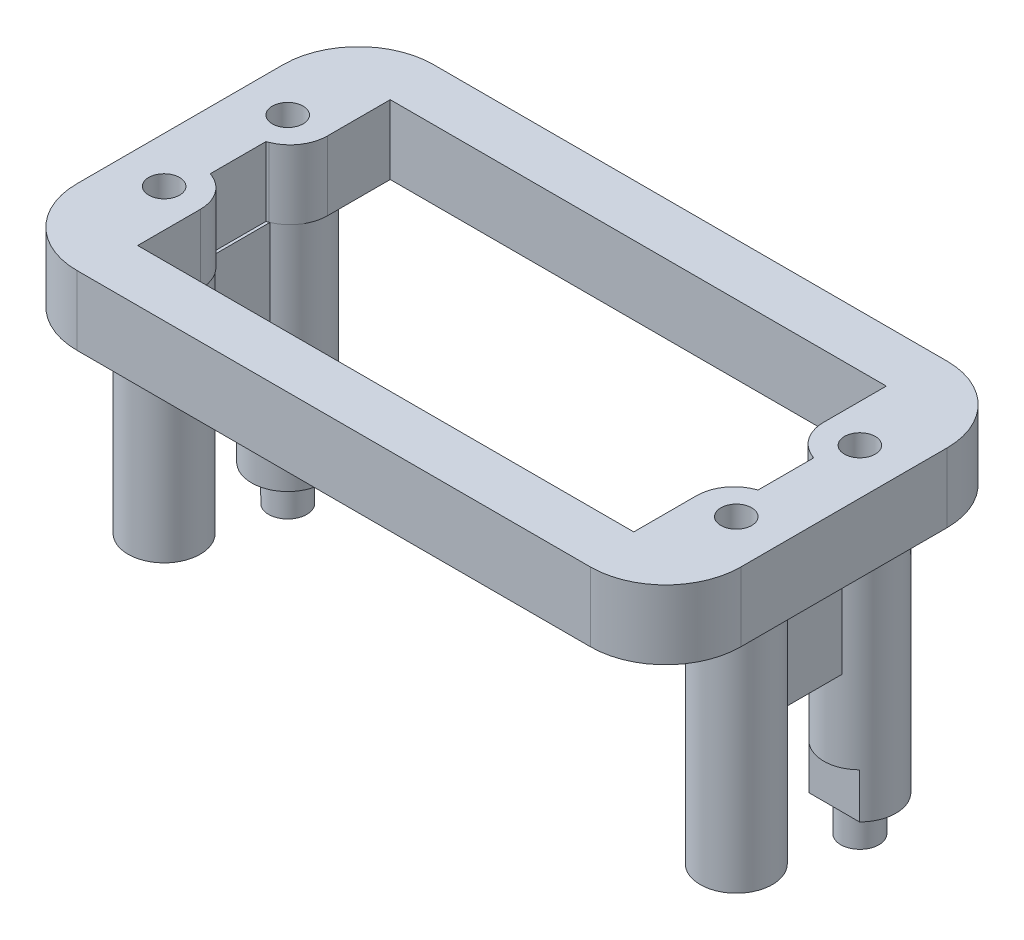
from build123d import *

# Parameters (mm, degrees)
SKETCH1_R           = 3.048
SKETCH1_R_2         = 1.2319
BOSS_EXTRUDE1_DEPTH = 25.4
SKETCH2_W           = 56.0832
SKETCH2_H           = 30.1244
BOSS_EXTRUDE3_DEPTH = 5.842
FILLET1_R           = 3.175
FILLET3_R           = 6.35
SKETCH6_W           = 5.842
SKETCH6_H           = 8.89
BOSS_EXTRUDE4_DEPTH = 1.27
SKETCH7_W           = 5.842
SKETCH7_H           = 8.89
BOSS_EXTRUDE5_DEPTH = 1.27
SKETCH16_R          = 1.6129
BOSS_EXTRUDE6_DEPTH = 3.0226
SKETCH19_R          = 1.30175
CUT_EXTRUDE1_DEPTH  = 63.809652383
SKETCH20_R          = 1.30175
CUT_EXTRUDE2_DEPTH  = 63.809652383
BOSS_EXTRUDE7_START = -12.3825
SKETCH21_R          = 1.30175
SKETCH21_R_2        = 0.635
BOSS_EXTRUDE7_DEPTH = 12.3825
SKETCH24_W          = 6.93711536
SKETCH24_H          = 6.096
CUT_EXTRUDE4_DEPTH  = 3.81


with BuildPart() as part:
    # Sketch1 → Boss-Extrude1 (new body)
    # profile 1 of 8: a face of its own
    with BuildSketch(Plane(origin=(0, 0, 0), x_dir=(1, 0, 0), z_dir=(0, 1, 0))):
        with Locations(Location((0, -10.4394, 0), (0, 0, 270))):
            Circle(SKETCH1_R)
        with Locations((0, -10.4394)):
            Circle(SKETCH1_R_2, mode=Mode.SUBTRACT)
    # profile 2 of 8: a face of its own
    with BuildSketch(Plane(origin=(0, 0, 0), x_dir=(1, 0, 0), z_dir=(0, 1, 0))):
        with Locations((0, -10.4394)):
            Circle(SKETCH1_R_2)
    # profile 3 of 8: a face of its own
    with BuildSketch(Plane(origin=(0, 0, 0), x_dir=(1, 0, 0), z_dir=(0, 1, 0))):
        with Locations(Location((0, 0, 0), (0, 0, 270))):
            Circle(SKETCH1_R)
        Circle(SKETCH1_R_2, mode=Mode.SUBTRACT)
    # profile 4 of 8: a face of its own
    with BuildSketch(Plane(origin=(0, 0, 0), x_dir=(1, 0, 0), z_dir=(0, 1, 0))):
        Circle(SKETCH1_R_2)
    # profile 5 of 8: a face of its own
    with BuildSketch(Plane(origin=(0, 0, 0), x_dir=(1, 0, 0), z_dir=(0, 1, 0))):
        with Locations(Location((-48.3362, -10.4394, 0), (0, 0, 270))):
            Circle(SKETCH1_R)
        with Locations((-48.3362, -10.4394)):
            Circle(SKETCH1_R_2, mode=Mode.SUBTRACT)
    # profile 6 of 8: a face of its own
    with BuildSketch(Plane(origin=(0, 0, 0), x_dir=(1, 0, 0), z_dir=(0, 1, 0))):
        with Locations((-48.3362, -10.4394)):
            Circle(SKETCH1_R_2)
    # profile 7 of 8: a face of its own
    with BuildSketch(Plane(origin=(0, 0, 0), x_dir=(1, 0, 0), z_dir=(0, 1, 0))):
        with Locations(Location((-48.3362, 0, 0), (0, 0, 270))):
            Circle(SKETCH1_R)
        with Locations((-48.3362, 0)):
            Circle(SKETCH1_R_2, mode=Mode.SUBTRACT)
    # profile 8 of 8: a face of its own
    with BuildSketch(Plane(origin=(0, 0, 0), x_dir=(1, 0, 0), z_dir=(0, 1, 0))):
        with Locations((-48.3362, 0)):
            Circle(SKETCH1_R_2)
    extrude(amount=-BOSS_EXTRUDE1_DEPTH)

    # Sketch2 → Boss-Extrude3 (add)
    with BuildSketch(Plane(origin=(0, 0, 0), x_dir=(1, 0, 0), z_dir=(0, 1, 0))):
        with Locations((-24.1681, -5.2197)):
            Rectangle(SKETCH2_W, SKETCH2_H)
        Polygon((-47.3075, -2.794), (-45.1231, -2.794), (-45.1231, 5.4483), (-3.2131, 5.4483), (-3.2131, -2.794), (-1.0287, -2.794), (-1.0287, -7.6454), (-3.2131, -7.6454), (-3.2131, -15.8877), (-45.1231, -15.8877), (-45.1231, -7.6454), (-47.3075, -7.6454), align=None, mode=Mode.SUBTRACT)
    extrude(amount=-BOSS_EXTRUDE3_DEPTH)

    # Fillet1
    # the kernel refuses this fillet: 3.175 mm, written as the material it takes off along each edge
    with BuildSketch(Plane(origin=(-3.2131, 7.368907547, 7.6454), x_dir=(1, 0, 0), z_dir=(0, -1, 0)), Plane(origin=(-45.1231, 7.368907547, 2.794), x_dir=(-1, 0, 0), z_dir=(0, -1, 0))) as fillet1_piece_1:
        with BuildLine():
            CenterArc((3.175, 2.947563019), FILLET1_R, 180, 68.181567229)
            Line((0, 2.947563019), (-0.0635, 2.947563019))
            Line((-0.0635, 2.947563019), (-0.0635, 0))
            Line((-0.0635, 0), (0, -0.0635))
            ThreePointArc((0, -0.0635), (0.997479397, -0.0635), (1.971357969, -0.05895126))
            Line((1.971357969, -0.05895126), (1.994958793, 0))
        make_face()
    extrude(amount=20.579815094, mode=Mode.SUBTRACT)
    with BuildSketch(Plane(origin=(-3.2131, 7.368907547, 2.794), x_dir=(0, 0, -1), z_dir=(0, -1, 0)), Plane(origin=(-45.1231, 7.368907547, 7.6454), x_dir=(0, 0, 1), z_dir=(0, -1, 0))) as fillet1_piece_2:
        with BuildLine():
            CenterArc((2.947563019, 3.175), FILLET1_R, 201.818432771, 68.181567229)
            Line((0, 1.994958793), (-0.05895126, 1.971357969))
            ThreePointArc((-0.05895126, 1.971357969), (-0.0635, 0.997479397), (-0.0635, 0))
            Line((-0.0635, 0), (0, -0.0635))
            Line((0, -0.0635), (2.947563019, -0.0635))
            Line((2.947563019, -0.0635), (2.947563019, 0))
        make_face()
    extrude(amount=20.579815094, mode=Mode.SUBTRACT)

    # Fillet3
    fillet3_edges = [part.edges().sort_by_distance(p)[0] for p in [
        (3.8735, -2.921, -9.8425),
        (3.8735, -2.921, 20.2819),
        (-52.2097, -2.921, 20.2819),
        (-52.2097, -2.921, -9.8425),
    ]]
    fillet(fillet3_edges, radius=FILLET3_R)

    # Sketch6 → Boss-Extrude4 (add, symmetric)
    with BuildSketch(Plane(origin=(0, 0, 0), x_dir=(0, 0, -1), z_dir=(1, 0, 0))):
        with Locations((-5.2197, -10.287)):
            Rectangle(SKETCH6_W, SKETCH6_H)
    extrude(amount=BOSS_EXTRUDE4_DEPTH, both=True)

    # Sketch7 → Boss-Extrude5 (add, symmetric)
    with BuildSketch(Plane.ZY.offset(48.3362)):
        with Locations((5.2197, -10.287)):
            Rectangle(SKETCH7_W, SKETCH7_H)
    extrude(amount=BOSS_EXTRUDE5_DEPTH, both=True)

    # Sketch16 → Boss-Extrude6 (add)
    with BuildSketch(Plane.XZ.offset(25.4)):
        with Locations(Location((0, 0, 0), (0, 0, 90))):
            Circle(SKETCH16_R)
        with Locations(Location((-48.3362, 0, 0), (0, 0, 90))):
            Circle(SKETCH16_R)
    extrude(amount=BOSS_EXTRUDE6_DEPTH)

    # Sketch19 → Cut-Extrude1 (cut, through all)
    with BuildSketch(Plane(origin=(0, 0, 0), x_dir=(1, 0, 0), z_dir=(0, 1, 0))):
        with Locations(Location((-48.3362, -10.4394, 0), (0, 0, 270))):
            Circle(SKETCH19_R)
        with Locations(Location((0, -10.4394, 0), (0, 0, 270))):
            Circle(SKETCH19_R)
    extrude(amount=-CUT_EXTRUDE1_DEPTH, mode=Mode.SUBTRACT)

    # Sketch20 → Cut-Extrude2 (cut, through all)
    with BuildSketch(Plane(origin=(0, 0, 0), x_dir=(1, 0, 0), z_dir=(0, 1, 0))):
        with Locations(Location((0, 0, 0), (0, 0, 270))):
            Circle(SKETCH20_R)
        with Locations(Location((-48.3362, 0, 0), (0, 0, 270))):
            Circle(SKETCH20_R)
    extrude(amount=-CUT_EXTRUDE2_DEPTH, mode=Mode.SUBTRACT)

    # Sketch21 → Boss-Extrude7 (add)
    # profile 1 of 2: a face of its own
    with BuildSketch(Plane.XZ.offset(28.4226).offset(BOSS_EXTRUDE7_START)):
        with Locations(Location((-48.3362, 0, 0), (0, 0, 90))):
            Circle(SKETCH21_R)
        with Locations(Location((-48.3362, 0, 0), (0, 0, 270))):
            Circle(SKETCH21_R_2, mode=Mode.SUBTRACT)
    # profile 2 of 2: a face of its own
    with BuildSketch(Plane.XZ.offset(28.4226).offset(BOSS_EXTRUDE7_START)):
        with Locations(Location((0, 0, 0), (0, 0, 90))):
            Circle(SKETCH21_R)
        with Locations(Location((0, 0, 0), (0, 0, 270))):
            Circle(SKETCH21_R_2, mode=Mode.SUBTRACT)
    extrude(amount=BOSS_EXTRUDE7_DEPTH)

    # Sketch24 → Cut-Extrude4 (cut)
    with BuildSketch(Plane.XZ.offset(25.4)):
        with Locations((0, 5.2197)):
            Rectangle(SKETCH24_W, SKETCH24_H)
    extrude(amount=-CUT_EXTRUDE4_DEPTH, mode=Mode.SUBTRACT)


solid = part.part
